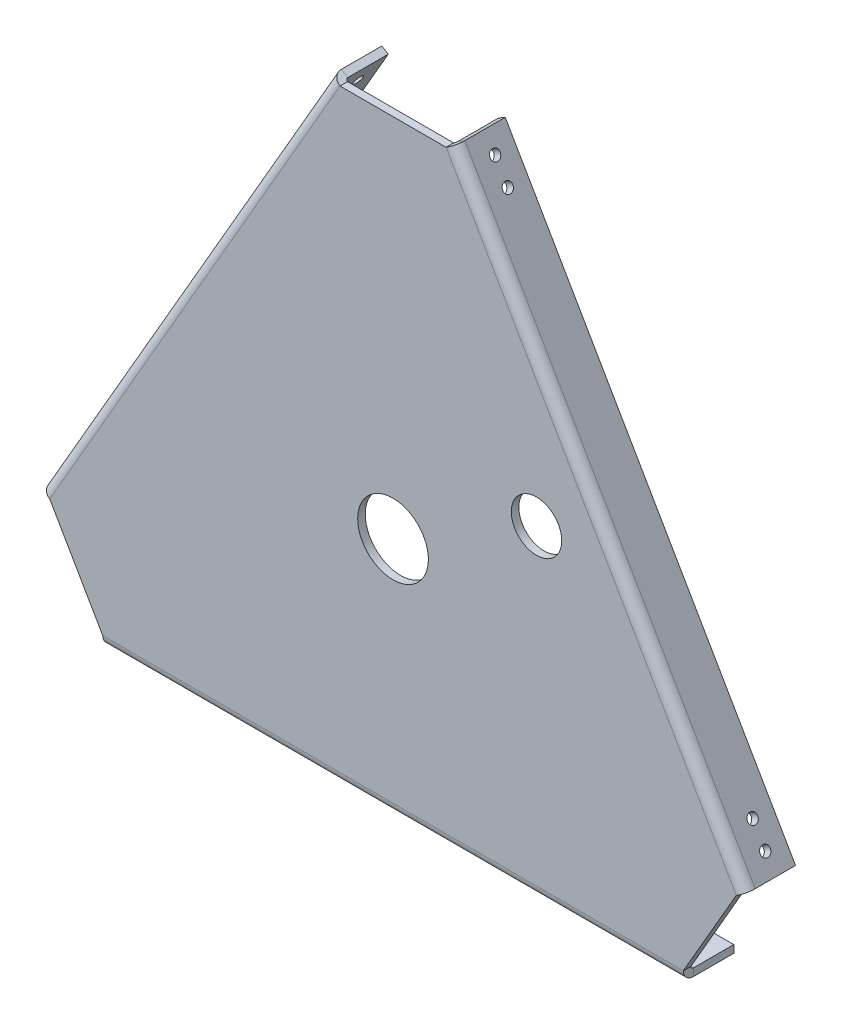
from build123d import *

# Parameters (mm, degrees)
SKETCH_10_R                   = 10
SM_BASE_FLANGE_3_DEPTH        = 3
SM_EDGE_FLANGE_6_DEPTH        = 230
SM_EDGE_FLANGE_6_BEND_DEPTH   = 230
SM_EDGE_FLANGE_6_BEND_2_DEPTH = 230
CUT_EXTRUDE_4_REACH           = 364.518
SKETCH_47_R                   = 2
CUT_EXTRUDE_6_REACH           = 265.651
SKETCH_50_R                   = 2
CUT_EXTRUDE_7_REACH           = 353.429
SKETCH_51_R                   = 2
CUT_EXTRUDE_8_REACH           = 350.533
SKETCH_52_R                   = 14


# Sheet-metal steps are written as plain solids
with BuildPart() as part:
    # Эскиз10 → Базовая кромка3 (new body)
    with BuildSketch(Plane.XY):
        Polygon((0, 0), (-21, 36.373066959), (94, 235.558909829), (136, 235.558909829), (251, 36.373066959), (230, 0), align=None)
        with Locations((171.849364905, 123.465988394)):
            Circle(SKETCH_10_R, mode=Mode.SUBTRACT)
    extrude(amount=-SM_BASE_FLANGE_3_DEPTH)

    # Ребро-кромка6 section (across the edge) → Ребро-кромка6 (add)
    with BuildSketch(Plane(origin=(-21.866025404, 36.873066959, -3), x_dir=(0.8660254037844436, -0.4999999999999914, -3.4914813388431334e-15), z_dir=(0.4999999999999914, 0.8660254037844436, 0))):
        with BuildLine():
            Line((-3, 1), (-3, 17))
            Line((-3, 17), (0, 17))
            Line((0, 17), (0, 1))
            ThreePointArc((0, 1), (0.292893219, 0.292893219), (1, 0))
            Line((1, 0), (1, -3))
            ThreePointArc((1, -3), (-1.828427125, -1.828427125), (-3, 1))
        make_face()
    extrude(amount=SM_EDGE_FLANGE_6_DEPTH)

    # Ребро-кромка6 section 2 (across the edge) → Ребро-кромка6 bend (add)
    with BuildSketch(Plane(origin=(136.866025404, 236.058909829, -3), x_dir=(-0.8660254037844363, -0.5000000000000041, -3.4914813388431334e-15), z_dir=(0.5000000000000041, -0.8660254037844363, 0))):
        with BuildLine():
            Line((-3, 1), (-3, 17))
            Line((-3, 17), (0, 17))
            Line((0, 17), (0, 1))
            ThreePointArc((0, 1), (0.292893219, 0.292893219), (1, 0))
            Line((1, 0), (1, -3))
            ThreePointArc((1, -3), (-1.828427125, -1.828427125), (-3, 1))
        make_face()
    extrude(amount=SM_EDGE_FLANGE_6_BEND_DEPTH)

    # Ребро-кромка6 section 3 (across the edge) → Ребро-кромка6 bend 2 (add)
    with BuildSketch(Plane(origin=(230, -1, -3), x_dir=(0, 1, 0), z_dir=(-1, 0, 0))):
        with BuildLine():
            Line((-3, 1), (-3, 17))
            Line((-3, 17), (0, 17))
            Line((0, 17), (0, 1))
            ThreePointArc((0, 1), (0.292893219, 0.292893219), (1, 0))
            Line((1, 0), (1, -3))
            ThreePointArc((1, -3), (-1.828427125, -1.828427125), (-3, 1))
        make_face()
    extrude(amount=SM_EDGE_FLANGE_6_BEND_2_DEPTH)

    # Эскиз47 → Вырез-Вытянуть4 (cut, up to next)
    with BuildSketch(Plane(origin=(-34.964101615, 20.186533479, 0), x_dir=(0, 0, 1), z_dir=(-0.866025403784443, 0.4999999999999925, 3.788649256556814e-15)), mode=Mode.PRIVATE) as cut_extrude_4_sk1:
        with Locations(Location((-12, 29, 0), (0, 0, 270))):
            Circle(SKETCH_47_R)
    cut_extrude_4_tool1 = extrude(cut_extrude_4_sk1.sketch, amount=-CUT_EXTRUDE_4_REACH, mode=Mode.PRIVATE) & part.part
    # Эскиз47 → Вырез-Вытянуть4 (cut, up to next)
    with BuildSketch(Plane(origin=(-34.964101615, 20.186533479, 0), x_dir=(0, 0, 1), z_dir=(-0.866025403784443, 0.4999999999999925, 3.788649256556814e-15)), mode=Mode.PRIVATE) as cut_extrude_4_sk2:
        with Locations(Location((-12, 39, 0), (0, 0, 270))):
            Circle(SKETCH_47_R)
    cut_extrude_4_tool2 = extrude(cut_extrude_4_sk2.sketch, amount=-CUT_EXTRUDE_4_REACH, mode=Mode.PRIVATE) & part.part
    # Эскиз47 → Вырез-Вытянуть4 (cut, up to next)
    with BuildSketch(Plane(origin=(-34.964101615, 20.186533479, 0), x_dir=(0, 0, 1), z_dir=(-0.866025403784443, 0.4999999999999925, 3.788649256556814e-15)), mode=Mode.PRIVATE) as cut_extrude_4_sk3:
        with Locations(Location((-12, 233, 0), (0, 0, 270))):
            Circle(SKETCH_47_R)
    cut_extrude_4_tool3 = extrude(cut_extrude_4_sk3.sketch, amount=-CUT_EXTRUDE_4_REACH, mode=Mode.PRIVATE) & part.part
    # Эскиз47 → Вырез-Вытянуть4 (cut, up to next)
    with BuildSketch(Plane(origin=(-34.964101615, 20.186533479, 0), x_dir=(0, 0, 1), z_dir=(-0.866025403784443, 0.4999999999999925, 3.788649256556814e-15)), mode=Mode.PRIVATE) as cut_extrude_4_sk4:
        with Locations(Location((-12, 243, 0), (0, 0, 270))):
            Circle(SKETCH_47_R)
    cut_extrude_4_tool4 = extrude(cut_extrude_4_sk4.sketch, amount=-CUT_EXTRUDE_4_REACH, mode=Mode.PRIVATE) & part.part
    add(cut_extrude_4_tool1.solids().sort_by_distance((-20.464102, 45.30127, -12))[0], mode=Mode.SUBTRACT)
    add(cut_extrude_4_tool2.solids().sort_by_distance((-15.464102, 53.961524, -12))[0], mode=Mode.SUBTRACT)
    add(cut_extrude_4_tool3.solids().sort_by_distance((81.535898, 221.970453, -12))[0], mode=Mode.SUBTRACT)
    add(cut_extrude_4_tool4.solids().sort_by_distance((86.535898, 230.630707, -12))[0], mode=Mode.SUBTRACT)

    # Эскиз50 → Вырез-Вытянуть6 (cut, up to next)
    with BuildSketch(Plane(origin=(207.464101615, 119.779454915, 0), x_dir=(0, 0, -1), z_dir=(0.866025403784436, 0.5000000000000047, 3.0623287353932815e-15)), mode=Mode.PRIVATE) as cut_extrude_6_sk1:
        with Locations(Location((12, -86, 0), (0, 0, 90))):
            Circle(SKETCH_50_R)
    cut_extrude_6_tool1 = extrude(cut_extrude_6_sk1.sketch, amount=-CUT_EXTRUDE_6_REACH, mode=Mode.PRIVATE) & part.part
    # Эскиз50 → Вырез-Вытянуть6 (cut, up to next)
    with BuildSketch(Plane(origin=(207.464101615, 119.779454915, 0), x_dir=(0, 0, -1), z_dir=(0.866025403784436, 0.5000000000000047, 3.0623287353932815e-15)), mode=Mode.PRIVATE) as cut_extrude_6_sk2:
        with Locations(Location((12, -76, 0), (0, 0, 90))):
            Circle(SKETCH_50_R)
    cut_extrude_6_tool2 = extrude(cut_extrude_6_sk2.sketch, amount=-CUT_EXTRUDE_6_REACH, mode=Mode.PRIVATE) & part.part
    # Эскиз50 → Вырез-Вытянуть6 (cut, up to next)
    with BuildSketch(Plane(origin=(207.464101615, 119.779454915, 0), x_dir=(0, 0, -1), z_dir=(0.866025403784436, 0.5000000000000047, 3.0623287353932815e-15)), mode=Mode.PRIVATE) as cut_extrude_6_sk3:
        with Locations(Location((12, 118, 0), (0, 0, 90))):
            Circle(SKETCH_50_R)
    cut_extrude_6_tool3 = extrude(cut_extrude_6_sk3.sketch, amount=-CUT_EXTRUDE_6_REACH, mode=Mode.PRIVATE) & part.part
    # Эскиз50 → Вырез-Вытянуть6 (cut, up to next)
    with BuildSketch(Plane(origin=(207.464101615, 119.779454915, 0), x_dir=(0, 0, -1), z_dir=(0.866025403784436, 0.5000000000000047, 3.0623287353932815e-15)), mode=Mode.PRIVATE) as cut_extrude_6_sk4:
        with Locations(Location((12, 128, 0), (0, 0, 90))):
            Circle(SKETCH_50_R)
    cut_extrude_6_tool4 = extrude(cut_extrude_6_sk4.sketch, amount=-CUT_EXTRUDE_6_REACH, mode=Mode.PRIVATE) & part.part
    add(cut_extrude_6_tool1.solids().sort_by_distance((250.464102, 45.30127, -12))[0], mode=Mode.SUBTRACT)
    add(cut_extrude_6_tool2.solids().sort_by_distance((245.464102, 53.961524, -12))[0], mode=Mode.SUBTRACT)
    add(cut_extrude_6_tool3.solids().sort_by_distance((148.464102, 221.970453, -12))[0], mode=Mode.SUBTRACT)
    add(cut_extrude_6_tool4.solids().sort_by_distance((143.464102, 230.630707, -12))[0], mode=Mode.SUBTRACT)

    # Эскиз51 → Вырез-Вытянуть7 (cut, up to next)
    with BuildSketch(Plane.XZ.offset(4), mode=Mode.PRIVATE) as cut_extrude_7_sk1:
        with Locations(Location((222, -12, 0), (0, 0, 270))):
            Circle(SKETCH_51_R)
    cut_extrude_7_tool1 = extrude(cut_extrude_7_sk1.sketch, amount=-CUT_EXTRUDE_7_REACH, mode=Mode.PRIVATE) & part.part
    # Эскиз51 → Вырез-Вытянуть7 (cut, up to next)
    with BuildSketch(Plane.XZ.offset(4), mode=Mode.PRIVATE) as cut_extrude_7_sk2:
        with Locations(Location((212, -12, 0), (0, 0, 270))):
            Circle(SKETCH_51_R)
    cut_extrude_7_tool2 = extrude(cut_extrude_7_sk2.sketch, amount=-CUT_EXTRUDE_7_REACH, mode=Mode.PRIVATE) & part.part
    # Эскиз51 → Вырез-Вытянуть7 (cut, up to next)
    with BuildSketch(Plane.XZ.offset(4), mode=Mode.PRIVATE) as cut_extrude_7_sk3:
        with Locations(Location((18, -12, 0), (0, 0, 270))):
            Circle(SKETCH_51_R)
    cut_extrude_7_tool3 = extrude(cut_extrude_7_sk3.sketch, amount=-CUT_EXTRUDE_7_REACH, mode=Mode.PRIVATE) & part.part
    # Эскиз51 → Вырез-Вытянуть7 (cut, up to next)
    with BuildSketch(Plane.XZ.offset(4), mode=Mode.PRIVATE) as cut_extrude_7_sk4:
        with Locations(Location((8, -12, 0), (0, 0, 270))):
            Circle(SKETCH_51_R)
    cut_extrude_7_tool4 = extrude(cut_extrude_7_sk4.sketch, amount=-CUT_EXTRUDE_7_REACH, mode=Mode.PRIVATE) & part.part
    add(cut_extrude_7_tool1.solids().sort_by_distance((222, -4, -12))[0], mode=Mode.SUBTRACT)
    add(cut_extrude_7_tool2.solids().sort_by_distance((212, -4, -12))[0], mode=Mode.SUBTRACT)
    add(cut_extrude_7_tool3.solids().sort_by_distance((18, -4, -12))[0], mode=Mode.SUBTRACT)
    add(cut_extrude_7_tool4.solids().sort_by_distance((8, -4, -12))[0], mode=Mode.SUBTRACT)

    # Эскиз52 → Вырез-Вытянуть8 (cut, up to next)
    with BuildSketch(Plane(origin=(0, 0, -3), x_dir=(-1, 0, 0), z_dir=(0, 0, -1)), mode=Mode.PRIVATE) as cut_extrude_8_sk1:
        with Locations((-115, 90.643992263)):
            Circle(SKETCH_52_R)
    cut_extrude_8_tool1 = extrude(cut_extrude_8_sk1.sketch, amount=-CUT_EXTRUDE_8_REACH, mode=Mode.PRIVATE) & part.part
    add(cut_extrude_8_tool1.solids().sort_by_distance((115, 90.643992, -3))[0], mode=Mode.SUBTRACT)


solid = part.part
